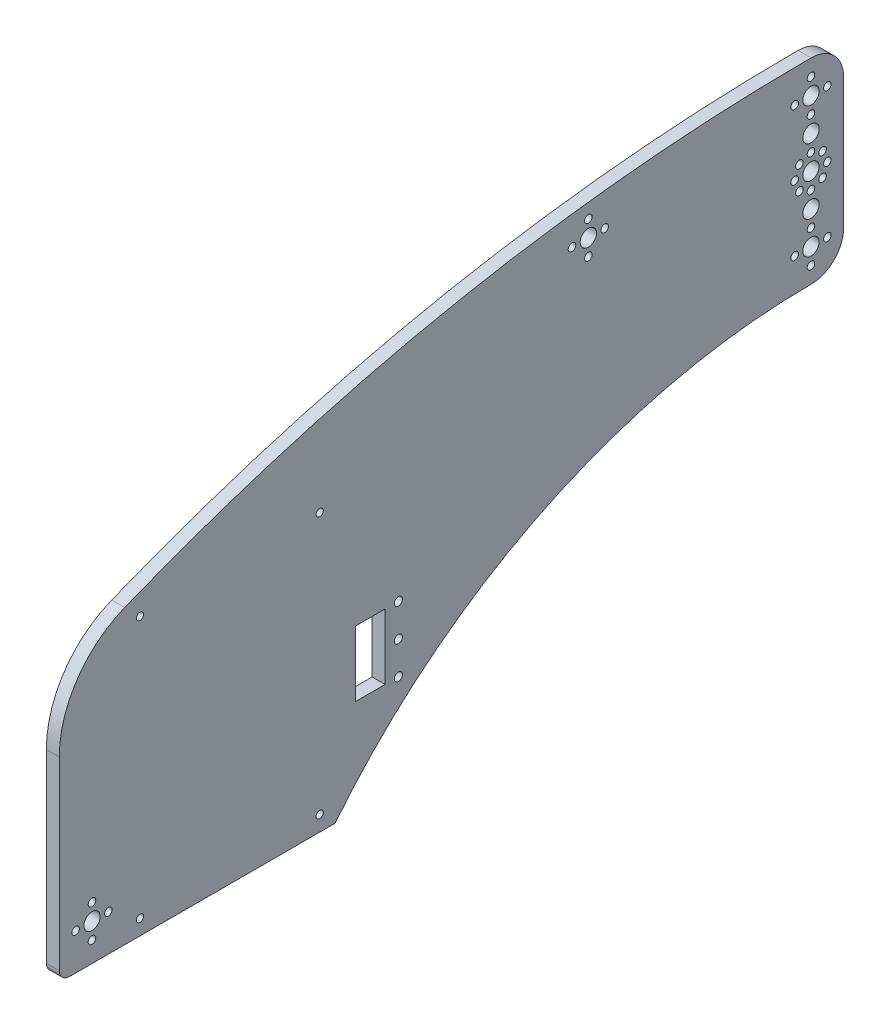
from build123d import *

# Parameters (mm, degrees)
SKETCH1_R           = 4
SKETCH1_R_2         = 1.85
SKETCH1_R_3         = 1.75
SKETCH1_R_4         = 2
SKETCH1_W           = 14.5
SKETCH1_H           = 32
BOSS_EXTRUDE2_DEPTH = 6.35


with BuildPart() as part:
    # Sketch1 → Boss-Extrude2 (new body)
    with BuildSketch(Plane(origin=(0, 0, 0), x_dir=(0, 0, -1), z_dir=(1, 0, 0))):
        with BuildLine():
            Line((-16, 77.649446494), (-16, -13))
            ThreePointArc((-16, -13), (-14.535533906, -16.535533906), (-11, -18))
            Line((-11, -18), (119, -18))
            ThreePointArc((119, -18), (222.7396039, 64.546181173), (352, 94))
            ThreePointArc((352, 94), (363.313708499, 98.686291501), (368, 110))
            Line((368, 110), (368, 174))
            ThreePointArc((368, 174), (363.313708499, 185.313708499), (352, 190))
            ThreePointArc((352, 190), (180.885272405, 173.600745723), (16, 125))
            ThreePointArc((16, 125), (-7.249835994, 106.224238345), (-16, 77.649446494))
        make_face()
        with Locations((352, 110)):
            Circle(SKETCH1_R, mode=Mode.SUBTRACT)
        with Locations((352, 118)):
            Circle(SKETCH1_R_2, mode=Mode.SUBTRACT)
        with Locations((352, 126)):
            Circle(SKETCH1_R, mode=Mode.SUBTRACT)
        with Locations((352, 134)):
            Circle(SKETCH1_R_2, mode=Mode.SUBTRACT)
        with Locations((352, 142)):
            Circle(SKETCH1_R, mode=Mode.SUBTRACT)
        with Locations((360, 110)):
            Circle(SKETCH1_R_2, mode=Mode.SUBTRACT)
        with Locations((352, 102)):
            Circle(SKETCH1_R_2, mode=Mode.SUBTRACT)
        with Locations((344, 110)):
            Circle(SKETCH1_R_2, mode=Mode.SUBTRACT)
        with Locations((346.343145751, 136.343145751)):
            Circle(SKETCH1_R_2, mode=Mode.SUBTRACT)
        with Locations((344, 142)):
            Circle(SKETCH1_R_2, mode=Mode.SUBTRACT)
        with Locations((346.343145751, 147.656854249)):
            Circle(SKETCH1_R_2, mode=Mode.SUBTRACT)
        with Locations((352, 150)):
            Circle(SKETCH1_R_2, mode=Mode.SUBTRACT)
        with Locations((357.656854249, 147.656854249)):
            Circle(SKETCH1_R_2, mode=Mode.SUBTRACT)
        with Locations((360, 142)):
            Circle(SKETCH1_R_2, mode=Mode.SUBTRACT)
        with Locations((357.656854249, 136.343145751)):
            Circle(SKETCH1_R_2, mode=Mode.SUBTRACT)
        with Locations((344, 174)):
            Circle(SKETCH1_R_2, mode=Mode.SUBTRACT)
        with Locations((352, 182)):
            Circle(SKETCH1_R_2, mode=Mode.SUBTRACT)
        with Locations((360, 174)):
            Circle(SKETCH1_R_2, mode=Mode.SUBTRACT)
        with Locations((352, 158)):
            Circle(SKETCH1_R, mode=Mode.SUBTRACT)
        with Locations((352, 166)):
            Circle(SKETCH1_R_2, mode=Mode.SUBTRACT)
        with Locations((352, 174)):
            Circle(SKETCH1_R, mode=Mode.SUBTRACT)
        Circle(SKETCH1_R, mode=Mode.SUBTRACT)
        with Locations((8, 0)):
            Circle(SKETCH1_R_2, mode=Mode.SUBTRACT)
        with Locations((0, -8)):
            Circle(SKETCH1_R_2, mode=Mode.SUBTRACT)
        with Locations((-8, 0)):
            Circle(SKETCH1_R_2, mode=Mode.SUBTRACT)
        with Locations((0, 8)):
            Circle(SKETCH1_R_2, mode=Mode.SUBTRACT)
        with Locations((23.5, 117.5)):
            Circle(SKETCH1_R_3, mode=Mode.SUBTRACT)
        with Locations((111.5, 117.5)):
            Circle(SKETCH1_R_3, mode=Mode.SUBTRACT)
        with Locations((111.5, -10.5)):
            Circle(SKETCH1_R_3, mode=Mode.SUBTRACT)
        with Locations((23.5, -10.5)):
            Circle(SKETCH1_R_3, mode=Mode.SUBTRACT)
        with Locations((150, 28.62526107)):
            Circle(SKETCH1_R_4, mode=Mode.SUBTRACT)
        with Locations((150, 44.62526107)):
            Circle(SKETCH1_R_4, mode=Mode.SUBTRACT)
        with Locations((150, 60.62526107)):
            Circle(SKETCH1_R_4, mode=Mode.SUBTRACT)
        with Locations((243, 168.269053261)):
            Circle(SKETCH1_R, mode=Mode.SUBTRACT)
        with Locations((251, 168.269053261)):
            Circle(SKETCH1_R_2, mode=Mode.SUBTRACT)
        with Locations((243, 160.269053261)):
            Circle(SKETCH1_R_2, mode=Mode.SUBTRACT)
        with Locations((235, 168.269053261)):
            Circle(SKETCH1_R_2, mode=Mode.SUBTRACT)
        with Locations((243, 176.269053261)):
            Circle(SKETCH1_R_2, mode=Mode.SUBTRACT)
        with Locations((136.25, 44.62526107)):
            Rectangle(SKETCH1_W, SKETCH1_H, mode=Mode.SUBTRACT)
    extrude(amount=BOSS_EXTRUDE2_DEPTH)


solid = part.part
